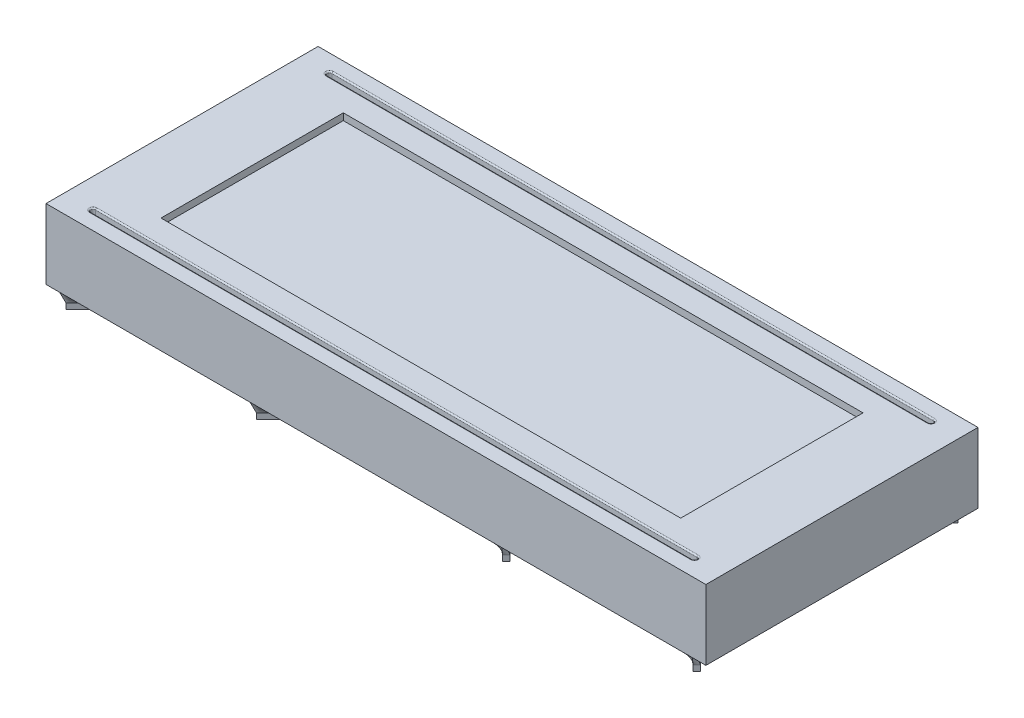
from build123d import *

# Parameters (mm, degrees)
SKETCH1_W           = 97
SKETCH1_H           = 40
SKETCH1_W_2         = 76.4
SKETCH1_H_2         = 26.8
BOSS_EXTRUDE2_DEPTH = 1
FILLET1_R           = 0.2
SKETCH2_W           = 97
SKETCH2_H           = 40
BOSS_EXTRUDE3_DEPTH = 9.3
LPATTERN1_COUNT     = 2
LPATTERN1_PITCH     = 28


# Read off the part's stored shape, not the designer's step: Mirror1, Mirror2
with BuildPart() as part:
    # Sketch1 → Boss-Extrude2 (new body)
    with BuildSketch(Plane(origin=(0, 0, 0), x_dir=(1, 0, 0), z_dir=(0, 1, 0))):
        with Locations((48.5, 20)):
            Rectangle(SKETCH1_W, SKETCH1_H)
        with Locations((48.5, 20)):
            Rectangle(SKETCH1_W_2, SKETCH1_H_2, mode=Mode.SUBTRACT)
        with BuildLine():
            Line((4.3, 37.75), (92.7, 37.75))
            ThreePointArc((92.7, 37.75), (93.075, 37.375), (92.7, 37))
            Line((92.7, 37), (4.3, 37))
            ThreePointArc((4.3, 37), (3.925, 37.375), (4.3, 37.75))
        make_face(mode=Mode.SUBTRACT)
        with BuildLine():
            Line((4.3, 2.25), (92.7, 2.25))
            ThreePointArc((92.7, 2.25), (93.075, 2.625), (92.7, 3))
            Line((92.7, 3), (4.3, 3))
            ThreePointArc((4.3, 3), (3.925, 2.625), (4.3, 2.25))
        make_face(mode=Mode.SUBTRACT)
    extrude(amount=BOSS_EXTRUDE2_DEPTH)

    # Fillet1
    fillet1_edges = [part.edges().sort_by_distance(p)[0] for p in [
        (3.925, 1, -37.375),
        (48.5, 1, -37),
        (93.075, 1, -37.375),
        (48.5, 1, -37.75),
        (3.925, 1, -2.625),
        (48.5, 1, -2.25),
        (93.075, 1, -2.625),
        (48.5, 1, -3),
    ]]
    fillet(fillet1_edges, radius=FILLET1_R)

    # Sketch2 → Boss-Extrude3 (add)
    with BuildSketch(Plane.XZ):
        with Locations((48.5, -20)):
            Rectangle(SKETCH2_W, SKETCH2_H)
    extrude(amount=BOSS_EXTRUDE3_DEPTH)

    # Sketch3 → Loft1 section 0
    with BuildSketch(Plane.XZ.offset(9.3)):
        with BuildLine():
            Line((2, 0), (3.5, 0))
            Line((3.5, 0), (3.5, -0.7))
            Line((3.5, -0.7), (2, -0.7))
            Line((2, -0.7), (2, 0))
        make_face()
    # Sketch5 → Loft1 section 1
    with BuildSketch(Plane(origin=(0, -10.7, 0), x_dir=(-1, 0, 0), z_dir=(0, -1, 0))):
        with BuildLine():
            Line((-2.4, 0.530034721), (-3.460660172, 1.590694893))
            Line((-3.460660172, 1.590694893), (-2.930330086, 2.121024979))
            Line((-2.930330086, 2.121024979), (-1.869669914, 1.060364807))
            Line((-1.869669914, 1.060364807), (-2.4, 0.530034721))
        make_face()
    loft1 = loft()

    # Sketch4 → Loft2 section 0
    with BuildSketch(Plane(origin=(0, -11.55, 0), x_dir=(-1, 0, 0), z_dir=(0, -1, 0))):
        with BuildLine():
            Line((-2.4, 0.530034721), (-5.935533906, 4.065568627))
            Line((-5.935533906, 4.065568627), (-5.40520382, 4.595898713))
            Line((-5.40520382, 4.595898713), (-1.869669914, 1.060364807))
            Line((-1.869669914, 1.060364807), (-2.4, 0.530034721))
        make_face()
    # Sketch6 → Loft2 section 1
    with BuildSketch(Plane(origin=(0, -10.7, 0), x_dir=(-1, 0, 0), z_dir=(0, -1, 0))):
        with BuildLine():
            Line((-5.935533906, 4.065568627), (-5.40520382, 4.595898713))
            Line((-5.40520382, 4.595898713), (-1.869669914, 1.060364807))
            Line((-1.869669914, 1.060364807), (-2.4, 0.530034721))
            Line((-2.4, 0.530034721), (-5.935533906, 4.065568627))
        make_face()
    loft2 = loft()

    # LPattern1: Loft1, Loft2 ×2
    with Locations(*[(i * LPATTERN1_PITCH, 0, 0) for i in range(1, LPATTERN1_COUNT)]):
        add(loft1)
        add(loft2)

    # Mirror1: part across plane


with BuildPart() as part_1:
    add(part.part)
    add(part.part.mirror(Plane(origin=(48.5, 0, 0), x_dir=(0, 0, 1), z_dir=(1, 0, 0))))

    # Mirror2: part across plane


with BuildPart() as part_2:
    add(part_1.part)
    add(part_1.part.mirror(Plane.XY.offset(-20)))


solid = part_2.part
